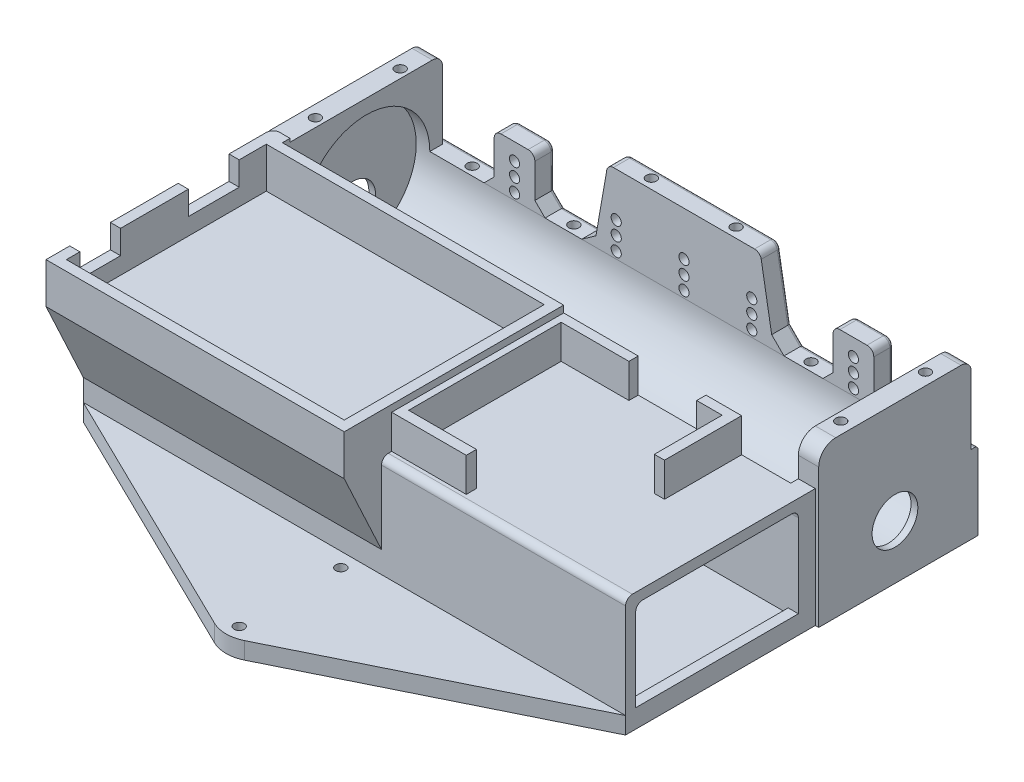
from build123d import *
from build123d.topology import SkipClean

# Parameters (mm, degrees)
BOSS_EXTRUDE1_DEPTH              = 3
SKETCH4_R                        = 18.750000000000004
SKETCH4_R_2                      = 6.75
BOSS_EXTRUDE2_DEPTH              = 1
SKETCH4_3_R                      = 18.750000000000004
BOSS_EXTRUDE3_DEPTH              = 5
BOSS_EXTRUDE4_START              = -1
SKETCH7_W                        = 45.00000000000003
SKETCH7_H                        = 40
SKETCH7_R                        = 18.750000000000007
SKETCH7_R_2                      = 6.7499999999999964
BOSS_EXTRUDE4_DEPTH              = 1
BOSS_EXTRUDE5_START              = -5
SKETCH7_3_W                      = 45.00000000000003
SKETCH7_3_H                      = 40
SKETCH7_3_R                      = 18.750000000000007
BOSS_EXTRUDE5_DEPTH              = 5
SKETCH8_W                        = 5.000000000000011
SKETCH8_H                        = 45.00000000000004
SKETCH8_W_2                      = 5
SKETCH8_H_2                      = 44.999999999999986
BOSS_EXTRUDE6_DEPTH              = 3
SKETCH10_W                       = 56
SKETCH10_H                       = 32.00000000000001
BOSS_EXTRUDE7_DEPTH              = 160
SKETCH11_W                       = 48.00000000000002
SKETCH11_H                       = 28.000000000000004
BOSS_EXTRUDE8_DEPTH              = 2
SKETCH12_W                       = 3
SKETCH12_H                       = 48.00000000000002
BOSS_EXTRUDE9_DEPTH              = 1.5
BOSS_EXTRUDE10_DEPTH             = 12
SKETCH14_W                       = 3
SKETCH14_H                       = 12
CUT_EXTRUDE2_DEPTH               = 7
SKETCH16_W                       = 53.50000000000003
SKETCH16_H                       = 53.00000000000001
BOSS_EXTRUDE12_DEPTH             = 10
SKETCH17_W                       = 19.99999999999997
SKETCH17_H                       = 4.999999999999986
CUT_EXTRUDE3_DEPTH               = 10
BOSS_EXTRUDE11_DEPTH             = 150
SKETCH29_W                       = 1.9999999999999991
SKETCH29_H                       = 22.999999999999993
BOSS_EXTRUDE17_DEPTH             = 160
BOSS_EXTRUDE18_START             = 1
SKETCH36_R                       = 6.75
BOSS_EXTRUDE18_DEPTH             = 1
SKETCH39_R                       = 6.7499999999999964
BOSS_EXTRUDE19_DEPTH             = 1
FILLET1_R                        = 3
FILLET3_R                        = 2
BOSS_EXTRUDE13_DEPTH             = 23
SKETCH20_R                       = 1.4999999999999973
CUT_EXTRUDE5_DEPTH               = 15
CUT_EXTRUDE6_DEPTH               = 247.94866348057985
BOSS_EXTRUDE14_DEPTH             = 2
SKETCH22_R                       = 1.4999999999999973
CUT_EXTRUDE7_DEPTH               = 241.45485440817072
FILLET4_R                        = 10
BOSS_EXTRUDE15_REACH             = 237.862
BOSS_EXTRUDE15_DIRECTION_2_REACH = 237.862
SKETCH25_W                       = 29.94682256034227
SKETCH25_H                       = 25.70974215012596
CUT_EXTRUDE9_DEPTH               = 10
FILLET5_R                        = 5
BOSS_EXTRUDE16_DEPTH             = 88
SKETCH28_R                       = 1.4999999999999973
SKETCH28_R_2                     = 1.5000000000000009
CUT_EXTRUDE11_DEPTH              = 10
FILLET6_R                        = 2
SKETCH30_R                       = 1.4999999999999973
SKETCH30_R_2                     = 1.5000000000000042
CUT_EXTRUDE12_DEPTH              = 10
CUT_EXTRUDE15_REACH              = 242.681
SKETCH33_W                       = 149.99999999999997
SKETCH33_H                       = 6
SKETCH40_W                       = 12
SKETCH40_H                       = 5.750000000000011
SKETCH40_W_2                     = 12.000000000000007
SKETCH40_H_2                     = 5.749999999999978
BOSS_EXTRUDE20_DEPTH             = 15
SKETCH34_R                       = 1.4999999999999973
SKETCH34_R_2                     = 1.5000000000000042
CUT_EXTRUDE16_DEPTH              = 8
CHAMFER1_SIZE                    = 3.686089746
CHAMFER1_SIZE_2                  = 3
CHAMFER2_SIZE                    = 3
FILLET8_R                        = 1
FILLET9_R                        = 2
FILLET10_R                       = 2


with BuildPart() as part:
    # Sketch3 → Boss-Extrude1 (new body)
    with BuildSketch(Plane(origin=(0, 0, 0), x_dir=(1, 0, 0), z_dir=(0, 1, 0))):
        Polygon((23.596786086051342, -8.024267002081887), (183.59678608605134, -8.024267002081887), (183.59678608605137, -158.0242670020819), (23.59678608605136, -158.0242670020819), align=None)
    extrude(amount=BOSS_EXTRUDE1_DEPTH)

    # Sketch4 → Boss-Extrude2 (add)
    # profile 1 of 2: a face of its own
    with BuildSketch(Plane(origin=(183.59678608605134, 0, -3.397e-14), x_dir=(-1.9e-16, 0, -1), z_dir=(1, 0, -1.9e-16))):
        Polygon((-53.02426700208193, 2.9999999999999947), (-8.02426700208192, 3), (-8.024267002081933, 43), (-53.024267002081935, 43), align=None)
        with Locations((-30.52426700208192, 22.999999999999996)):
            Circle(SKETCH4_R, mode=Mode.SUBTRACT)
    # profile 2 of 2: a face of its own
    with BuildSketch(Plane(origin=(183.59678608605134, 0, -3.397e-14), x_dir=(-1.9e-16, 0, -1), z_dir=(1, 0, -1.9e-16))):
        with Locations((-30.52426700208192, 22.999999999999996)):
            Circle(SKETCH4_R)
        with Locations((-30.52426700208192, 16)):
            Circle(SKETCH4_R_2, mode=Mode.SUBTRACT)
    extrude(amount=-BOSS_EXTRUDE2_DEPTH)

    # Sketch4<3> → Boss-Extrude3 (add)
    with BuildSketch(Plane(origin=(183.59678608605134, 0, -3.397e-14), x_dir=(-1.9e-16, 0, -1), z_dir=(1, 0, -1.9e-16))):
        Polygon((-53.02426700208193, 2.9999999999999947), (-8.02426700208192, 3), (-8.024267002081933, 43), (-53.024267002081935, 43), align=None)
        with Locations((-30.52426700208192, 22.999999999999996)):
            Circle(SKETCH4_3_R, mode=Mode.SUBTRACT)
    extrude(amount=-BOSS_EXTRUDE3_DEPTH)

    # Sketch7 → Boss-Extrude4 (add)
    # profile 1 of 2: a face of its own
    with BuildSketch(Plane.ZY.offset(-23.596786086051342).offset(BOSS_EXTRUDE4_START)):
        with Locations((30.524267002081906, 23)):
            Rectangle(SKETCH7_W, SKETCH7_H)
        with Locations(Location((30.52426700208191, 22.999999999999996, 0), (0, 0, 180))):
            Circle(SKETCH7_R, mode=Mode.SUBTRACT)
    # profile 2 of 2: a face of its own
    with BuildSketch(Plane.ZY.offset(-23.596786086051342).offset(BOSS_EXTRUDE4_START)):
        with Locations(Location((30.52426700208191, 22.999999999999996, 0), (0, 0, 180))):
            Circle(SKETCH7_R)
        with Locations(Location((30.52426700208191, 16, 0), (0, 0, 180))):
            Circle(SKETCH7_R_2, mode=Mode.SUBTRACT)
    extrude(amount=BOSS_EXTRUDE4_DEPTH)

    # Sketch7<3> → Boss-Extrude5 (add)
    with BuildSketch(Plane.ZY.offset(-23.596786086051342).offset(BOSS_EXTRUDE5_START)):
        with Locations((30.524267002081906, 23)):
            Rectangle(SKETCH7_3_W, SKETCH7_3_H)
        with Locations(Location((30.52426700208191, 22.999999999999996, 0), (0, 0, 180))):
            Circle(SKETCH7_3_R, mode=Mode.SUBTRACT)
    extrude(amount=BOSS_EXTRUDE5_DEPTH)

    # Sketch8 → Boss-Extrude6 (add)
    with BuildSketch(Plane(origin=(0, 43, 0), x_dir=(1, 0, 0), z_dir=(0, 1, 0))):
        with Locations((26.096786086051345, -30.524267002081906)):
            Rectangle(SKETCH8_W, SKETCH8_H)
        with Locations((181.0967860860513, -30.524267002081892)):
            Rectangle(SKETCH8_W_2, SKETCH8_H_2)
    extrude(amount=BOSS_EXTRUDE6_DEPTH)



with BuildPart() as body_2:
    # Sketch10 → Boss-Extrude7 (new body)
    with BuildSketch(Plane(origin=(183.59678608605134, 0, -3.397e-14), x_dir=(-1.9e-16, 0, -1), z_dir=(1, 0, -1.9e-16))):
        with Locations((-81.02426700208193, 19.000000000000004)):
            Rectangle(SKETCH10_W, SKETCH10_H)
        Polygon((-106.02426700208193, 32), (-58.02426700208192, 32.00000000000001), (-58.02426700208192, 4), (-106.02426700208193, 4), align=None, mode=Mode.SUBTRACT)
    extrude(amount=-BOSS_EXTRUDE7_DEPTH)


with BuildPart() as part_1:
    add(part.part)

    add(body_2.part)  # Boss-Extrude8 merges body 2
    # Sketch11 → Boss-Extrude8 (add)
    with BuildSketch(Plane.ZY.offset(-23.596786086051342)):
        with Locations((82.02426700208191, 18.000000000000007)):
            Rectangle(SKETCH11_W, SKETCH11_H)
    extrude(amount=-BOSS_EXTRUDE8_DEPTH)

    # Sketch12 → Boss-Extrude9 (add)
    with BuildSketch(Plane(origin=(0, 4, 0), x_dir=(1, 0, 0), z_dir=(0, 1, 0))):
        with Locations((182.09678608605137, -82.02426700208191)):
            Rectangle(SKETCH12_W, SKETCH12_H)
    extrude(amount=BOSS_EXTRUDE9_DEPTH)

    # Sketch13 → Boss-Extrude10 (add)
    with BuildSketch(Plane(origin=(0, 35.00000000000001, 0), x_dir=(1, 0, 0), z_dir=(0, 1, 0))):
        Polygon((23.59678608605135, -120.02426700208191), (111.59678608605134, -120.02426700208191), (111.59678608605135, -53.02426700208192), (23.59678608605135, -53.02426700208192), align=None)
        Polygon((26.596786086051345, -117.0242670020819), (108.59678608605135, -117.0242670020819), (108.59678608605135, -58.02426700208191), (26.59678608605135, -58.02426700208191), align=None, mode=Mode.SUBTRACT)
    extrude(amount=BOSS_EXTRUDE10_DEPTH)

    # Sketch14 → Cut-Extrude2 (cut)
    with BuildSketch(Plane(origin=(0, 47.000000000000014, 0), x_dir=(1, 0, 0), z_dir=(0, 1, 0))):
        Polygon((23.59678608605135, -66.02426700208191), (26.59678608605135, -66.02426700208191), (26.596786086051353, -81.02426700208191), (23.596786086051353, -81.0242670020819), align=None)
        with Locations((25.09678608605135, -107.0242670020819)):
            Rectangle(SKETCH14_W, SKETCH14_H)
    extrude(amount=-CUT_EXTRUDE2_DEPTH, mode=Mode.SUBTRACT)

    # Sketch16 → Boss-Extrude12 (add)
    with BuildSketch(Plane(origin=(0, 35.00000000000001, 0), x_dir=(1, 0, 0), z_dir=(0, 1, 0))):
        with Locations((137.34678608605134, -79.52426700208193)):
            Rectangle(SKETCH16_W, SKETCH16_H)
        Polygon((113.59678608605132, -58.02426700208191), (161.09678608605134, -58.02426700208191), (161.09678608605134, -103.02426700208193), (113.59678608605134, -103.02426700208193), align=None, mode=Mode.SUBTRACT)
    extrude(amount=BOSS_EXTRUDE12_DEPTH)

    # Sketch17 → Cut-Extrude3 (cut)
    with BuildSketch(Plane(origin=(0, 45.000000000000014, 0), x_dir=(1, 0, 0), z_dir=(0, 1, 0))):
        Polygon((133.5967860860513, -103.02426700208193), (153.59678608605128, -103.02426700208193), (153.59678608605128, -106.02426700208193), (133.59678608605134, -106.02426700208193), align=None)
        with Locations((143.59678608605134, -55.52426700208191)):
            Rectangle(SKETCH17_W, SKETCH17_H)
        Polygon((161.09678608605134, -98.02426700208191), (164.09678608605134, -98.02426700208191), (164.09678608605134, -78.02426700208191), (161.0967860860513, -78.02426700208191), align=None)
    extrude(amount=-CUT_EXTRUDE3_DEPTH, mode=Mode.SUBTRACT)

    # Sketch15 → Boss-Extrude11 (add)
    with SkipClean():  # the faces are left unmerged after this step: merging them gives an invalid solid
        with BuildSketch(Plane.ZY.offset(-178.5967860860513)):
            with BuildLine():
                Line((11.774267002081922, 22.999999999999993), (8.02426700208189, 22.999999999999996))
                Line((8.02426700208189, 22.999999999999996), (8.024267002081892, 3))
                Line((8.024267002081924, 3), (53.02426700208193, 3))
                Line((53.02426700208193, 3), (53.024267002081935, 22.999999999999996))
                Line((53.024267002081935, 22.999999999999996), (49.27426700208193, 22.999999999999996))
                ThreePointArc((49.27426700208193, 22.999999999999993), (30.52426700208192, 4.249999999999989), (11.774267002081917, 23))
            make_face()
        extrude(amount=BOSS_EXTRUDE11_DEPTH)

    # Sketch29 → Boss-Extrude17 (add)
    with SkipClean():  # the faces are left unmerged after this step: merging them gives an invalid solid
        with BuildSketch(Plane(origin=(183.59678608605134, 0, -3.397e-14), x_dir=(-1.9e-16, 0, -1), z_dir=(1, 0, -1.9e-16))):
            with Locations((-7.0242670020819205, 11.499999999999996)):
                Rectangle(SKETCH29_W, SKETCH29_H)
        extrude(amount=-BOSS_EXTRUDE17_DEPTH)

    # Sketch36 → Boss-Extrude18 (add)
    with SkipClean():  # the faces are left unmerged after this step: merging them gives an invalid solid
        with BuildSketch(Plane(origin=(183.59678608605134, 0, -3.397e-14), x_dir=(-1.9e-16, 0, -1), z_dir=(1, 0, -1.9e-16)).offset(BOSS_EXTRUDE18_START)):
            Polygon((-53.02426700208193, 46), (-53.024267002081935, 0), (-6.024267002081921, 0), (-6.024267002081921, 22.999999999999993), (-8.024267002081933, 22.999999999999993), (-8.024267002081933, 46), align=None)
            with Locations((-30.52426700208192, 16)):
                Circle(SKETCH36_R, mode=Mode.SUBTRACT)
        extrude(amount=-BOSS_EXTRUDE18_DEPTH)

    # Sketch39 → Boss-Extrude19 (add)
    with SkipClean():  # the faces are left unmerged after this step: merging them gives an invalid solid
        with BuildSketch(Plane.ZY.offset(-23.596786086051342)):
            Polygon((8.02426700208189, 46), (8.02426700208189, 22.999999999999993), (6.02426700208192, 22.999999999999993), (6.02426700208192, 0), (53.02426700208191, 0), (53.02426700208191, 46), align=None)
            with Locations(Location((30.52426700208191, 16, 0), (0, 0, 180))):
                Circle(SKETCH39_R, mode=Mode.SUBTRACT)
        extrude(amount=BOSS_EXTRUDE19_DEPTH)

    # Fillet1
    fillet1_edges = [part_1.edges().sort_by_distance(p)[0] for p in [
        (181.0967860860513, 46, 8.0242670020819),
        (26.096786086051345, 46, 8.024267002081887),
    ]]
    fillet(fillet1_edges, radius=FILLET1_R)

    # Fillet3
    # the kernel refuses this fillet: 2 mm, written as the material it takes off along each edge
    with BuildSketch(Plane(origin=(23.59678608605135, 46, 53.02426700208192), x_dir=(1, 0, 0), z_dir=(0, 1, 0))) as fillet3_piece_1:
        with BuildLine():
            CenterArc((FILLET3_R, -FILLET3_R), FILLET3_R, 90, 90.00000000000023)
            Line((-1.066e-14, -FILLET3_R), (0, 0))
            Line((0, 0), (FILLET3_R, 0))
        make_face()
    extrude(amount=6.000000000000028, mode=Mode.SUBTRACT)

    # Sketch18 → Boss-Extrude13 (add)
    with BuildSketch(Plane(origin=(0, 23.000000000000004, 2.128e-14), x_dir=(1, 0, 0), z_dir=(0, 1, 6.9e-16))):
        Polygon((81.09678608605134, -11.774267002081892), (126.09678608605135, -11.774267002081883), (126.09678608605135, -6.024267002081884), (81.09678608605137, -6.024267002081893), align=None)
    extrude(amount=BOSS_EXTRUDE13_DEPTH)

    # Sketch20 → Cut-Extrude5 (cut)
    with BuildSketch(Plane(origin=(0, 46, 0), x_dir=(1, 0, 0), z_dir=(0, 1, 6.9e-16))):
        with Locations(Location((91.09678608605134, -8.899267002081928, 0), (0, 0, 270))):
            Circle(SKETCH20_R)
        with Locations(Location((116.09678608605134, -8.89926700208193, 0), (0, 0, 270))):
            Circle(SKETCH20_R)
    extrude(amount=-CUT_EXTRUDE5_DEPTH, mode=Mode.SUBTRACT)

    # Sketch21 → Cut-Extrude6 (cut, through all)
    with BuildSketch(Plane(origin=(0, 3, 0), x_dir=(1, 0, 0), z_dir=(0, 1, 0))):
        Polygon((183.59678608605137, -109.0242670020819), (103.82423922955661, -148.25168995716433), (23.59678608605135, -109.02426700208193), (23.59678608605136, -158.0242670020819), (183.59678608605137, -158.0242670020819), align=None)
    extrude(amount=-CUT_EXTRUDE6_DEPTH, mode=Mode.SUBTRACT)

    # Sketch23 → Boss-Extrude14 (add)
    with BuildSketch(Plane(origin=(0, 3, 0), x_dir=(1, 0, 0), z_dir=(0, 1, 0))):
        Polygon((23.59678608605135, -109.02426700208193), (183.59678608605137, -109.0242670020819), (103.82423922955662, -148.25168995716433), align=None)
    extrude(amount=BOSS_EXTRUDE14_DEPTH)

    # Sketch22 → Cut-Extrude7 (cut, through all)
    with BuildSketch(Plane(origin=(0, 5, 0), x_dir=(1, 0, 0), z_dir=(0, 1, 0))):
        with Locations(Location((103.82423922955661, -143.25168995716433, 0), (0, 0, 270))):
            Circle(SKETCH22_R)
        with Locations(Location((103.82423922955662, -113.25168995716433, 0), (0, 0, 270))):
            Circle(SKETCH22_R)
    extrude(amount=-CUT_EXTRUDE7_DEPTH, mode=Mode.SUBTRACT)

    # Fillet4
    fillet4_edges = [part_1.edges().sort_by_distance(p)[0] for p in [
        (103.82423922955661, 1.5, 148.25168995716433),
    ]]
    fillet(fillet4_edges, radius=FILLET4_R)

    # Boss-Extrude15: up to this face of the body (flat: up to its plane)
    boss_extrude15_end = Plane(part_1.part.faces().sort_by_distance((103.596786086, 34.5, 11.774267002))[0])
    # Sketch24 → Boss-Extrude15 (add, up to the picked face)
    with BuildSketch(Plane(origin=(0, 0, 8.024267002081887), x_dir=(-1, 0, 0), z_dir=(0, 0, -1)), mode=Mode.PRIVATE) as boss_extrude15_sk1:
        Polygon((-126.09678608605135, 46), (-130.09678608605134, 22.999999999999993), (-126.09678608605135, 22.999999999999993), align=None)
    boss_extrude15_tool1 = split(extrude(boss_extrude15_sk1.sketch, amount=-BOSS_EXTRUDE15_REACH, mode=Mode.PRIVATE), bisect_by=boss_extrude15_end, keep=Keep.BOTH, mode=Mode.PRIVATE)
    # Sketch24 → Boss-Extrude15 (add, up to the picked face)
    with BuildSketch(Plane(origin=(0, 0, 8.024267002081887), x_dir=(-1, 0, 0), z_dir=(0, 0, -1)), mode=Mode.PRIVATE) as boss_extrude15_sk2:
        Polygon((-81.09678608605137, 46), (-81.09678608605137, 23), (-77.09678608605137, 23), align=None)
    boss_extrude15_tool2 = split(extrude(boss_extrude15_sk2.sketch, amount=-BOSS_EXTRUDE15_REACH, mode=Mode.PRIVATE), bisect_by=boss_extrude15_end, keep=Keep.BOTH, mode=Mode.PRIVATE)
    add(boss_extrude15_tool1.solids().sort_by(Axis((127.430119, 30.666667, 8.024267), (0, 0, 1)))[0])
    add(boss_extrude15_tool2.solids().sort_by(Axis((79.763453, 30.666667, 8.024267), (0, 0, 1)))[0])

    # Boss-Extrude15 direction 2: up to this face of the body (flat: up to its plane)
    boss_extrude15_direction_2_end = Plane(part_1.part.faces().sort_by_distance((103.596786086, 16.5, 6.024267002))[0])
    # Sketch24 → Boss-Extrude15 direction 2 (add, up to the picked face)
    with BuildSketch(Plane(origin=(0, 0, 8.024267002081887), x_dir=(-1, 0, 0), z_dir=(0, 0, -1)), mode=Mode.PRIVATE) as boss_extrude15_direction_2_sk1:
        Polygon((-126.09678608605135, 46), (-130.09678608605134, 22.999999999999993), (-126.09678608605135, 22.999999999999993), align=None)
    boss_extrude15_direction_2_tool1 = split(extrude(boss_extrude15_direction_2_sk1.sketch, amount=BOSS_EXTRUDE15_DIRECTION_2_REACH, mode=Mode.PRIVATE), bisect_by=boss_extrude15_direction_2_end, keep=Keep.BOTH, mode=Mode.PRIVATE)
    # Sketch24 → Boss-Extrude15 direction 2 (add, up to the picked face)
    with BuildSketch(Plane(origin=(0, 0, 8.024267002081887), x_dir=(-1, 0, 0), z_dir=(0, 0, -1)), mode=Mode.PRIVATE) as boss_extrude15_direction_2_sk2:
        Polygon((-81.09678608605137, 46), (-81.09678608605137, 23), (-77.09678608605137, 23), align=None)
    boss_extrude15_direction_2_tool2 = split(extrude(boss_extrude15_direction_2_sk2.sketch, amount=BOSS_EXTRUDE15_DIRECTION_2_REACH, mode=Mode.PRIVATE), bisect_by=boss_extrude15_direction_2_end, keep=Keep.BOTH, mode=Mode.PRIVATE)
    add(boss_extrude15_direction_2_tool1.solids().sort_by(Axis((127.430119, 30.666667, 8.024267), (0, 0, -1)))[0])
    add(boss_extrude15_direction_2_tool2.solids().sort_by(Axis((79.763453, 30.666667, 8.024267), (0, 0, -1)))[0])

    # Sketch25 → Cut-Extrude9 (cut)
    with BuildSketch(Plane(origin=(0, 35.00000000000001, 0), x_dir=(1, 0, 0), z_dir=(0, 1, 0))):
        with Locations((159.8916895015239, -102.21354760845378)):
            Rectangle(SKETCH25_W, SKETCH25_H)
    extrude(amount=CUT_EXTRUDE9_DEPTH, mode=Mode.SUBTRACT)

    # Fillet5
    fillet5_edges = [part_1.edges().sort_by_distance(p)[0] for p in [
        (181.59678608605134, 46, 53.02426700208189),
    ]]
    fillet(fillet5_edges, radius=FILLET5_R)

    # Sketch26 → Boss-Extrude16 (add)
    with BuildSketch(Plane.ZY.offset(-23.596786086051342)):
        Polygon((120.02426700208191, 35.00000000000001), (109.02426700208193, 11.41042387439451), (109.02426700208193, 35.00000000000001), align=None)
    extrude(amount=-BOSS_EXTRUDE16_DEPTH)

    # Sketch28 → Cut-Extrude11 (cut)
    with BuildSketch(Plane(origin=(0, 46, 0), x_dir=(1, 0, 0), z_dir=(0, 1, 0))):
        with Locations(Location((181.0967860860513, -18.024267002081913, 0), (0, 0, 270))):
            Circle(SKETCH28_R)
        with Locations(Location((181.0967860860513, -43.02426700208192, 0), (0, 0, 270))):
            Circle(SKETCH28_R)
        with Locations(Location((26.0967860860514, -43.024267002081906, 0), (0, 0, 317.59402355))):
            Circle(SKETCH28_R_2)
        with Locations(Location((26.0967860860514, -18.02426700208193, 0), (0, 0, 180.000016168))):
            Circle(SKETCH28_R_2)
    extrude(amount=-CUT_EXTRUDE11_DEPTH, mode=Mode.SUBTRACT)

    # Fillet6
    fillet6_edges = [part_1.edges().sort_by_distance(p)[0] for p in [
        (104.59678608605134, 32.00000000000001, 58.0242670020819),
        (104.59678608605137, 32, 106.02426700208191),
    ]]
    fillet(fillet6_edges, radius=FILLET6_R)

    # Sketch30 → Cut-Extrude12 (cut)
    with BuildSketch(Plane(origin=(0, 23.000000000000004, 2.128e-14), x_dir=(1, 0, 0), z_dir=(0, 1, 1.07e-15))):
        with Locations(Location((138.59678608605134, -9.274267002081888, 0), (0, 0, 270))):
            Circle(SKETCH30_R)
        with Locations(Location((168.59678608605134, -9.274267002081888, 0), (0, 0, 270))):
            Circle(SKETCH30_R)
        with Locations(Location((168.59678608605134, -51.77426700208184, 0), (0, 0, 236.442690238))):
            Circle(SKETCH30_R)
        with Locations(Location((138.59678608605134, -51.77426700208184, 0), (0, 0, 236.442690238))):
            Circle(SKETCH30_R)
        with Locations(Location((68.59678608605132, -51.77426700208184, 0), (0, 0, 270))):
            Circle(SKETCH30_R)
        with Locations(Location((38.596786086051324, -51.77426700208184, 0), (0, 0, 270))):
            Circle(SKETCH30_R_2)
        with Locations(Location((38.596786086051324, -9.274267002081887, 0), (0, 0, 90))):
            Circle(SKETCH30_R_2)
        with Locations(Location((68.59678608605132, -9.274267002081887, 0), (0, 0, 90))):
            Circle(SKETCH30_R)
    extrude(amount=-CUT_EXTRUDE12_DEPTH, mode=Mode.SUBTRACT)

    # Cut-Extrude15: up to this face of the body (flat: up to its plane)
    cut_extrude15_end = Plane(part_1.part.faces().sort_by_distance((103.596786086, 23, 51.120411225))[0])
    # Sketch33 → Cut-Extrude15 (cut, up to the picked face)
    with BuildSketch(Plane(origin=(0, 47.000000000000014, 0), x_dir=(1, 0, 0), z_dir=(0, 1, 0)), mode=Mode.PRIVATE) as cut_extrude15_sk1:
        with Locations((103.59678608605132, -52.27426700208192)):
            Rectangle(SKETCH33_W, SKETCH33_H)
    cut_extrude15_tool1 = split(extrude(cut_extrude15_sk1.sketch, amount=-CUT_EXTRUDE15_REACH, mode=Mode.PRIVATE), bisect_by=cut_extrude15_end, keep=Keep.BOTH, mode=Mode.PRIVATE)
    add(cut_extrude15_tool1.solids().sort_by(Axis((103.596786, 47, 52.274267), (0, -1, 0)))[0], mode=Mode.SUBTRACT)

    # Sketch40 → Boss-Extrude20 (add)
    with BuildSketch(Plane(origin=(0, 23.000000000000004, 2.128e-14), x_dir=(1, 0, 0), z_dir=(0, 1, 9.3e-16))):
        with Locations((153.59678608605134, -8.899267002081881)):
            Rectangle(SKETCH40_W, SKETCH40_H)
        with Locations((53.59678608605134, -8.899267002081885)):
            Rectangle(SKETCH40_W_2, SKETCH40_H_2)
    extrude(amount=BOSS_EXTRUDE20_DEPTH)

    # Sketch34 → Cut-Extrude16 (cut)
    with BuildSketch(Plane(origin=(1.11e-15, 0, 6.024267002081921), x_dir=(-1, 0, 1.9e-16), z_dir=(-1.9e-16, 0, -1))):
        with Locations((-153.59678608605134, 32.99999999999999)):
            Circle(SKETCH34_R)
        with Locations((-153.59678608605128, 28.999999999999993)):
            Circle(SKETCH34_R)
        with Locations((-153.59678608605125, 24.999999999999993)):
            Circle(SKETCH34_R)
        with Locations((-123.59678608605137, 32.99999999999999)):
            Circle(SKETCH34_R)
        with Locations((-123.59678608605137, 28.999999999999993)):
            Circle(SKETCH34_R)
        with Locations((-123.59678608605137, 24.999999999999993)):
            Circle(SKETCH34_R)
        with Locations((-103.59678608605135, 32.99999999999999)):
            Circle(SKETCH34_R)
        with Locations((-103.5967860860513, 28.999999999999993)):
            Circle(SKETCH34_R)
        with Locations((-103.59678608605127, 24.999999999999993)):
            Circle(SKETCH34_R)
        with Locations((-83.59678608605135, 32.99999999999999)):
            Circle(SKETCH34_R)
        with Locations((-83.59678608605135, 28.999999999999993)):
            Circle(SKETCH34_R)
        with Locations((-83.59678608605135, 24.999999999999993)):
            Circle(SKETCH34_R)
        with Locations((-53.59678608605137, 32.99999999999999)):
            Circle(SKETCH34_R_2)
        with Locations((-53.59678608605131, 28.999999999999993)):
            Circle(SKETCH34_R_2)
        with Locations((-53.59678608605128, 24.999999999999993)):
            Circle(SKETCH34_R_2)
    extrude(amount=-CUT_EXTRUDE16_DEPTH, mode=Mode.SUBTRACT)

    # Chamfer1
    # the kernel refuses this chamfer: 3.686089746, 3 mm, written as the material it adds along each edge
    with BuildSketch(Plane(origin=(130.09678608605134, 22.999999999999993, 6.024267002081908), x_dir=(-0.193254093094943, 0.981148742802054, 0), z_dir=(0, 0, 1))) as chamfer1_piece_1:
        Polygon((CHAMFER1_SIZE * 0.999751658051, -CHAMFER1_SIZE * 0.0222850259885), (-CHAMFER1_SIZE_2 * 0.193254093095, -CHAMFER1_SIZE_2 * 0.981148742802), (0, 0), align=None)
    extrude(amount=5.750000000000009)
    with BuildSketch(Plane(origin=(77.09678608605137, 23, 11.774267002081917), x_dir=(-0.9997516579715036, -0.022285025986742008, 0), z_dir=(0, 0, -1))) as chamfer1_piece_2:
        Polygon((CHAMFER1_SIZE * 0.999751658051, CHAMFER1_SIZE * 0.0222850259885), (-CHAMFER1_SIZE_2 * 0.193254093095, CHAMFER1_SIZE_2 * 0.981148742802), (0, 0), align=None)
    extrude(amount=5.750000000000009)

    # Chamfer2
    chamfer2_edges = [part_1.edges().sort_by_distance(p)[0] for p in [
        (147.59678608605134, 22.999999999999996, 8.899267002081903),
        (159.59678608605134, 22.999999999999996, 8.899267002081903),
        (47.59678608605134, 22.999999999999996, 8.899267002081906),
        (59.596786086051345, 22.999999999999996, 8.899267002081906),
    ]]
    chamfer(chamfer2_edges, length=CHAMFER2_SIZE)

    # Fillet8
    fillet8_edges = [part_1.edges().sort_by_distance(p)[0] for p in [
        (33.596786086051345, 22.999999999999993, 6.024267002081916),
        (103.59678608605137, 45.99999999999999, 6.024267002081926),
        (127.78099661236715, 36.31578947368415, 6.024267002081908),
        (147.59678608605134, 31.999999999999993, 6.0242670020819045),
        (159.59678608605134, 32, 6.0242670020819045),
        (153.59678608605134, 37.99999999999999, 6.024267002081911),
        (47.59678608605134, 31.999999999999996, 6.024267002081925),
        (59.596786086051345, 31.999999999999993, 6.024267002081925),
        (53.59678608605134, 37.99999999999999, 6.024267002081931),
        (138.8467860860511, 23, 6.024267002081902),
        (79.35379784817823, 35.97781763222942, 6.024267002081908),
        (131.2809966123666, 24.81578947368409, 6.024267002082),
        (75.51075297503104, 24.477817632229016, 6.024267002082),
        (68.00374121290461, 23, 6.024267002081915),
        (173.59678608605134, 22.999999999999993, 6.024267002081891),
        (46.09678608605134, 24.5, 6.024267002082),
        (61.09678608605133, 24.49999999999999, 6.024267002082),
        (161.09678608605134, 24.499999999999986, 6.024267002082),
        (146.09678608605134, 24.500000000000004, 6.024267002082),
    ]]
    fillet(fillet8_edges, radius=FILLET8_R)

    # Fillet9
    fillet9_edges = [part_1.edges().sort_by_distance(p)[0] for p in [
        (147.59678608605134, 35.00000000000001, 109.0242670020819),
    ]]
    fillet(fillet9_edges, radius=FILLET9_R)

    # Fillet10
    # the kernel refuses this fillet: 2 mm, written as the material it takes off along each edge
    with BuildSketch(Plane(origin=(49.59678608605134, 35.99999999999999, 6.024267002082), x_dir=(-1, 0, 0), z_dir=(0, -1, 0))) as fillet10_piece_1:
        with BuildLine():
            CenterArc((1, -1), 1, 0, 90)
            Line((2, -1), (2, 0))
            Line((2, 0), (1, 0))
        make_face()
    revolve(axis=Axis((49.59678608605134, 35.99999999999999, 6.024267002082), (0, 0, -1)), revolution_arc=90, mode=Mode.SUBTRACT)
    with BuildSketch(Plane(origin=(57.596786086051345, 35.99999999999999, 6.024267002082), x_dir=(0, 1, 9.3e-16), z_dir=(-1, 0, 0))) as fillet10_piece_2:
        with BuildLine():
            CenterArc((1, -1), 1, 0, 90)
            Line((2, -1), (2, 0))
            Line((2, 0), (1, 0))
        make_face()
    revolve(axis=Axis((57.596786086051345, 35.99999999999999, 6.024267002082), (0, 0, -1)), revolution_arc=90, mode=Mode.SUBTRACT)
    with BuildSketch(Plane(origin=(82.77898043908246, 43.99999999999999, 6.024267002082), x_dir=(-0.9852117548196745, 0.17134117475124774, 0), z_dir=(-0.17134117475124774, -0.9852117548196745, 0))) as fillet10_piece_3:
        with BuildLine():
            CenterArc((1, -1), 1, 0, 90)
            Line((2, -1), (2, 0))
            Line((2, 0), (1, 0))
        make_face()
    revolve(axis=Axis((82.77898043908246, 43.99999999999999, 6.024267002082), (0, 0, -1)), revolution_arc=80.13419305691563, mode=Mode.SUBTRACT)
    with BuildSketch(Plane(origin=(124.41459173302027, 44, 6.024267002082), x_dir=(0, 1, 6.9e-16), z_dir=(-1, 0, 0))) as fillet10_piece_4:
        with BuildLine():
            CenterArc((1, -1), 1, 0, 90)
            Line((2, -1), (2, 0))
            Line((2, 0), (1, 0))
        make_face()
    revolve(axis=Axis((124.41459173302027, 44, 6.024267002082), (0, 0, -1)), revolution_arc=80.13419305691568, mode=Mode.SUBTRACT)
    with BuildSketch(Plane(origin=(149.59678608605134, 35.99999999999999, 6.024267002082), x_dir=(-1, 0, 0), z_dir=(0, -1, 0))) as fillet10_piece_5:
        with BuildLine():
            CenterArc((1, -1), 1, 0, 90)
            Line((2, -1), (2, 0))
            Line((2, 0), (1, 0))
        make_face()
    revolve(axis=Axis((149.59678608605134, 35.99999999999999, 6.024267002082), (0, 0, -1)), revolution_arc=90, mode=Mode.SUBTRACT)
    with BuildSketch(Plane(origin=(157.59678608605134, 35.99999999999999, 6.024267002082), x_dir=(0, 1, 9.3e-16), z_dir=(-1, 0, 0))) as fillet10_piece_6:
        with BuildLine():
            CenterArc((1, -1), 1, 0, 90)
            Line((2, -1), (2, 0))
            Line((2, 0), (1, 0))
        make_face()
    revolve(axis=Axis((157.59678608605134, 35.99999999999999, 6.024267002082), (0, 0, -1)), revolution_arc=90, mode=Mode.SUBTRACT)
    with BuildSketch(Plane(origin=(126.09678608605135, 45.99999999999999, 6.024267002082001), x_dir=(0.17134117475125094, -0.9852117548196738, 0), z_dir=(0, 0, 1))) as fillet10_piece_7:
        with BuildLine():
            CenterArc((FILLET10_R * 0.841097176516, -FILLET10_R), FILLET10_R, 89.99999999999984, 80.13419305691603)
            Line((-FILLET10_R * 0.144114578304, -FILLET10_R * 0.828658825249), (0, 0))
            Line((0, 0), (FILLET10_R * 0.841097176516, 0))
        make_face()
    extrude(amount=9.955485882577648, mode=Mode.SUBTRACT)
    with BuildSketch(Plane(origin=(159.59678608605134, 37.99999999999999, 6.024267002082011), x_dir=(0, -1, -9.3e-16), z_dir=(0, -9.3e-16, 1))) as fillet10_piece_8:
        with BuildLine():
            CenterArc((FILLET10_R, -FILLET10_R), FILLET10_R, 90, 90)
            Line((0, -FILLET10_R), (0, 0))
            Line((0, 0), (FILLET10_R, 0))
        make_face()
    extrude(amount=10.74999999999993, mode=Mode.SUBTRACT)
    with BuildSketch(Plane(origin=(59.596786086051345, 37.99999999999999, 6.024267002082011), x_dir=(-1, 0, 0), z_dir=(0, -9.3e-16, 1))) as fillet10_piece_9:
        with BuildLine():
            CenterArc((FILLET10_R, FILLET10_R), FILLET10_R, 180, 90)
            Line((0, FILLET10_R), (0, 0))
            Line((0, 0), (FILLET10_R, 0))
        make_face()
    extrude(amount=10.749999999999917, mode=Mode.SUBTRACT)
    with BuildSketch(Plane(origin=(147.59678608605134, 37.999999999999986, 16.774267002081928), x_dir=(1, 0, 0), z_dir=(0, 9.3e-16, -1))) as fillet10_piece_10:
        with BuildLine():
            CenterArc((FILLET10_R, FILLET10_R), FILLET10_R, 180, 90)
            Line((0, FILLET10_R), (0, 0))
            Line((0, 0), (FILLET10_R, 0))
        make_face()
    extrude(amount=10.749999999999911, mode=Mode.SUBTRACT)
    with BuildSketch(Plane(origin=(47.59678608605134, 37.999999999999986, 16.77426700208191), x_dir=(0, -1, -9.3e-16), z_dir=(0, 9.3e-16, -1))) as fillet10_piece_11:
        with BuildLine():
            CenterArc((FILLET10_R, -FILLET10_R), FILLET10_R, 90, 90)
            Line((0, -FILLET10_R), (0, 0))
            Line((0, 0), (FILLET10_R, 0))
        make_face()
    extrude(amount=10.749999999999899, mode=Mode.SUBTRACT)
    with BuildSketch(Plane(origin=(81.09678608605137, 45.99999999999999, 6.024267002082011), x_dir=(1, 0, 2.47e-15), z_dir=(-2.47e-15, 0, 1))) as fillet10_piece_12:
        with BuildLine():
            CenterArc((FILLET10_R * 0.841097176516, -FILLET10_R), FILLET10_R, 90, 80.13419305691582)
            Line((-FILLET10_R * 0.144114578304, -FILLET10_R * 0.828658825249), (0, 0))
            Line((0, 0), (FILLET10_R * 0.841097176516, 0))
        make_face()
    extrude(amount=9.955485882577658, mode=Mode.SUBTRACT)


solid = part_1.part
